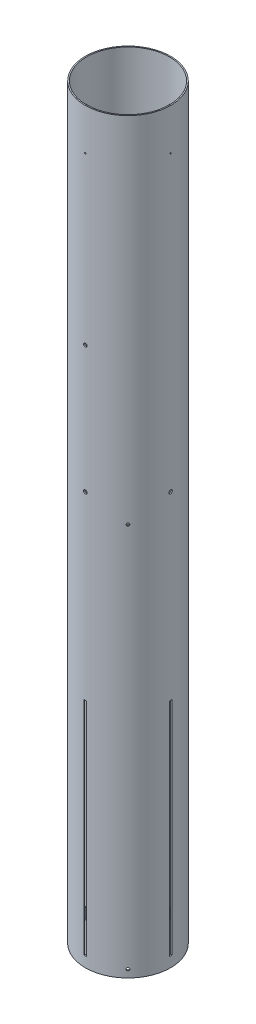
from build123d import *

# Parameters (mm, degrees)
SUSTAINER_TUBE_PROFILE_R       = 78.359
SUSTAINER_TUBE_PROFILE_R_2     = 76.2
SUSTAINER_TUBE_BODY_DEPTH      = 1371.6
FIN_SLOT_CUT_REACH             = 1384.746
FIN_SLOT_CUT_END_RADIUS        = 76.2
FIN_SLOT_PROFILE_W             = 4.7625
FIN_SLOT_PROFILE_H             = 406.4
FIN_SLOT_PATTERN_COUNT         = 4
SKETCH1_R                      = 1.143
CUT_EXTRUDE1_DEPTH             = 1377.069339009
CIRPATTERN1_COUNT              = 4
CUT_EXTRUDE2_DEPTH             = 1377.069339121
CUT_EXTRUDE2_DEPTH_BACK        = 1377.069339121
SKETCH2_R                      = 3.175
SKETCH3_R                      = 3.175
CUT_EXTRUDE3_DEPTH             = 1377.069339121
CIRPATTERN2_COUNT              = 4
CUT_EXTRUDE4_REACH             = 1386.584
CUT_EXTRUDE4_END_RADIUS        = 76.2
SKETCH4_R                      = 2.5019
CUT_EXTRUDE4_DIRECTION_2_DEPTH = 1385.584369896


with BuildPart() as part:
    # Sustainer Tube Profile → Sustainer Tube Body (new body)
    with BuildSketch(Plane(origin=(0, 0, 0), x_dir=(1, 0, 0), z_dir=(0, 1, 0))):
        Circle(SUSTAINER_TUBE_PROFILE_R)
        Circle(SUSTAINER_TUBE_PROFILE_R_2, mode=Mode.SUBTRACT)
    extrude(amount=SUSTAINER_TUBE_BODY_DEPTH)

    # Fin Slot Cut: up to this cylinder (the profile starts outside it)
    fin_slot_cut_end = Plane(origin=(0, 222.25, 0), z_dir=(0, -1, 0)) * Cylinder(FIN_SLOT_CUT_END_RADIUS, 2922.892, mode=Mode.PRIVATE)
    # Fin Slot Profile → Fin Slot Cut (cut, up to the surface)
    with BuildSketch(Plane.XY.offset(78.359), mode=Mode.PRIVATE) as fin_slot_cut_sk1:
        with Locations((0, 222.25)):
            Rectangle(FIN_SLOT_PROFILE_W, FIN_SLOT_PROFILE_H)
    fin_slot_cut_tool1 = extrude(fin_slot_cut_sk1.sketch, amount=-FIN_SLOT_CUT_REACH, mode=Mode.PRIVATE) - fin_slot_cut_end
    fin_slot_cut = fin_slot_cut_tool1.solids().sort_by_distance((0, 222.25, 78.359))[0]
    add(fin_slot_cut, mode=Mode.SUBTRACT)

    # Fin Slot Pattern: Fin Slot Cut ×4 about axis
    fin_slot_pattern_axis = Axis((0, 1371.6, 0), (0, 1, 0))
    for i in range(1, FIN_SLOT_PATTERN_COUNT):
        add(fin_slot_cut.rotate(fin_slot_pattern_axis, i * 360 / FIN_SLOT_PATTERN_COUNT), mode=Mode.SUBTRACT)

    # Sketch1 → Cut-Extrude1 (cut, symmetric)
    with BuildSketch(Plane.XY):
        with Locations((0, 1295.4)):
            Circle(SKETCH1_R)
    cut_extrude1 = extrude(amount=CUT_EXTRUDE1_DEPTH, both=True, mode=Mode.SUBTRACT)

    # CirPattern1: Cut-Extrude1 ×4 about axis
    cirpattern1_axis = Axis((0, 1371.6, 0), (0, 1, 0))
    for i in range(1, CIRPATTERN1_COUNT):
        add(cut_extrude1.rotate(cirpattern1_axis, i * 360 / CIRPATTERN1_COUNT), mode=Mode.SUBTRACT)

    # Sketch2 → Cut-Extrude2 (cut, two sides: drawn at the far end of the back side and taken through both)
    with BuildSketch(Plane.XY.offset(-CUT_EXTRUDE2_DEPTH_BACK)):
        with Locations((0, 990.6)):
            Circle(SKETCH2_R)
    extrude(amount=CUT_EXTRUDE2_DEPTH + CUT_EXTRUDE2_DEPTH_BACK, mode=Mode.SUBTRACT)

    # Sketch3 → Cut-Extrude3 (cut, symmetric)
    with BuildSketch(Plane.XY):
        with Locations((0, 756.9962)):
            Circle(SKETCH3_R)
    cut_extrude3 = extrude(amount=CUT_EXTRUDE3_DEPTH, both=True, mode=Mode.SUBTRACT)

    # CirPattern2: Cut-Extrude3 ×4 about axis
    cirpattern2_axis = Axis((0, 1371.6, 0), (0, 1, 0))
    for i in range(1, CIRPATTERN2_COUNT):
        add(cut_extrude3.rotate(cirpattern2_axis, i * 360 / CIRPATTERN2_COUNT), mode=Mode.SUBTRACT)

    # Cut-Extrude4: up to this cylinder (the profile starts outside it)
    cut_extrude4_end = Plane(origin=(0, 367.6523, 0), z_dir=(0, -1, 0)) * Cylinder(CUT_EXTRUDE4_END_RADIUS, 3633.7802, mode=Mode.PRIVATE)
    # Sketch4 → Cut-Extrude4 (cut, up to the surface)
    with BuildSketch(Plane(origin=(55.408180267, 0, 55.408180267), x_dir=(0, -1, 0), z_dir=(0.7071067811865488, 0, 0.7071067811865464)), mode=Mode.PRIVATE) as cut_extrude4_sk1:
        with Locations((-14.0462, 0)):
            Circle(SKETCH4_R)
    cut_extrude4_tool1 = extrude(cut_extrude4_sk1.sketch, amount=-CUT_EXTRUDE4_REACH, mode=Mode.PRIVATE) - cut_extrude4_end
    add(cut_extrude4_tool1.solids().sort_by_distance((55.40818, 14.0462, 55.40818))[0], mode=Mode.SUBTRACT)
    # Sketch4 → Cut-Extrude4 (cut, up to the surface)
    with BuildSketch(Plane(origin=(55.408180267, 0, 55.408180267), x_dir=(0, -1, 0), z_dir=(0.7071067811865488, 0, 0.7071067811865464)), mode=Mode.PRIVATE) as cut_extrude4_sk2:
        with Locations((-721.2584, 0)):
            Circle(SKETCH4_R)
    cut_extrude4_tool2 = extrude(cut_extrude4_sk2.sketch, amount=-CUT_EXTRUDE4_REACH, mode=Mode.PRIVATE) - cut_extrude4_end
    add(cut_extrude4_tool2.solids().sort_by_distance((55.40818, 721.2584, 55.40818))[0], mode=Mode.SUBTRACT)

    # Sketch4 → Cut-Extrude4 direction 2 (cut)
    with BuildSketch(Plane(origin=(55.408180267, 0, 55.408180267), x_dir=(0, -1, 0), z_dir=(0.7071067811865488, 0, 0.7071067811865464))):
        with Locations((-14.0462, 0)):
            Circle(SKETCH4_R)
        with Locations((-721.2584, 0)):
            Circle(SKETCH4_R)
    extrude(amount=CUT_EXTRUDE4_DIRECTION_2_DEPTH, mode=Mode.SUBTRACT)


solid = part.part
